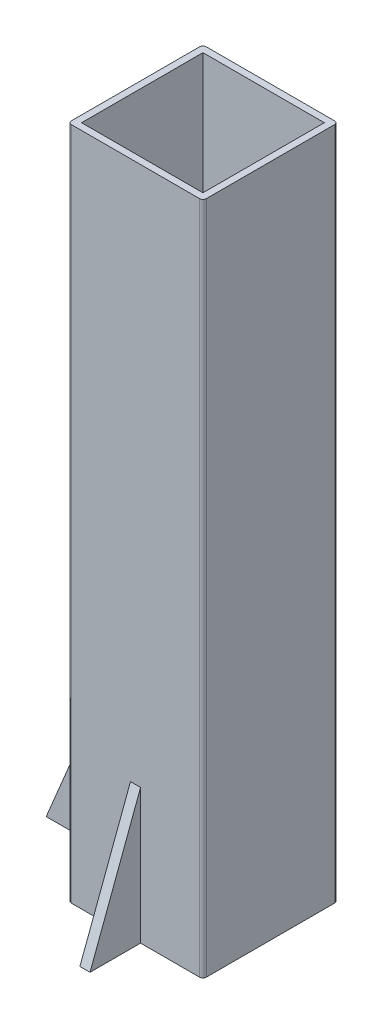
from build123d import *

# Parameters (mm, degrees)
SKETCH1_W           = 72
SKETCH1_H           = 72
BOSS_EXTRUDE1_DEPTH = 400
RIB2_START          = -3
RIB2_DEPTH          = 6
BOSS_EXTRUDE2_DEPTH = 3


# Read off the part's stored shape, not the designer's step: Rib2
with BuildPart() as part:
    # Sketch1 → Boss-Extrude1 (new body)
    with BuildSketch(Plane(origin=(0, 0, 0), x_dir=(1, 0, 0), z_dir=(0, 1, 0))):
        with BuildLine():
            Line((2, 0), (78, 0))
            ThreePointArc((78, 0), (79.414213562, 0.585786438), (80, 2))
            Line((80, 2), (80, 78))
            ThreePointArc((80, 78), (79.414213562, 79.414213562), (78, 80))
            Line((78, 80), (2, 80))
            ThreePointArc((2, 80), (0.585786438, 79.414213562), (0, 78))
            Line((0, 78), (0, 2))
            ThreePointArc((0, 2), (0.585786438, 0.585786438), (2, 0))
        make_face()
        with Locations((40, 40)):
            Rectangle(SKETCH1_W, SKETCH1_H, mode=Mode.SUBTRACT)
    extrude(amount=BOSS_EXTRUDE1_DEPTH)

    # Rib2 outline → Rib2 (add)
    with BuildSketch(Plane.ZY.offset(-40).offset(RIB2_START)):
        Polygon((0, 80), (0, 0), (30, 0), align=None)
    rib2 = extrude(amount=RIB2_DEPTH)

    # Mirror1: Rib2 across plane
    add(rib2.mirror(Plane(origin=(0, 0, -40), x_dir=(1, 0, 0), z_dir=(0, 0, -1))))

    # Sketch4 → Boss-Extrude2 (add, symmetric)
    with BuildSketch(Plane(origin=(0, 0, -40), x_dir=(-1, 0, 0), z_dir=(0, 0, -1))):
        Polygon((50, 0), (0, 120), (0, 0), align=None)
    extrude(amount=BOSS_EXTRUDE2_DEPTH, both=True)


solid = part.part
